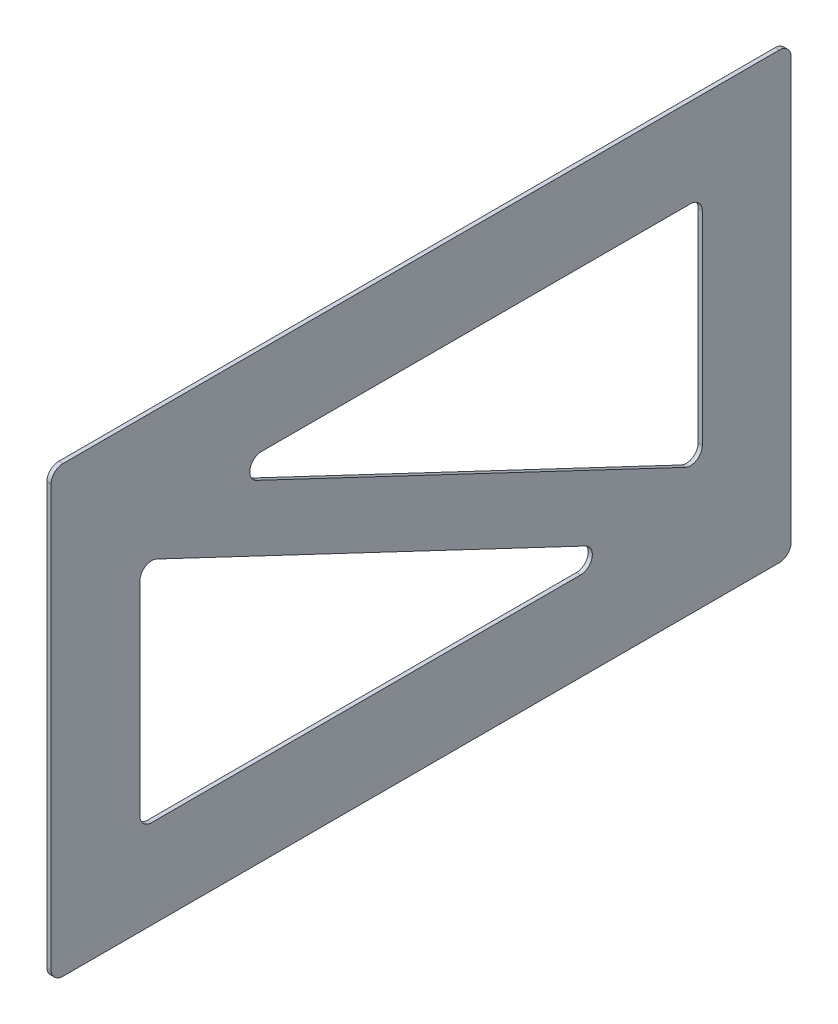
from build123d import *

# Parameters (mm, degrees)
SKETCH1_W          = 125
SKETCH1_H          = 75
BASE_FLANGE1_DEPTH = 0.7
CUT_EXTRUDE1_DEPTH = 10
FILLET1_R          = 2


# Sheet-metal steps are written as plain solids
with BuildPart() as part:
    # Sketch1 → Base-Flange1 (new body)
    with BuildSketch(Plane(origin=(0, 0, 0), x_dir=(0, 0, -1), z_dir=(1, 0, 0))):
        Rectangle(SKETCH1_W, SKETCH1_H)
    extrude(amount=-BASE_FLANGE1_DEPTH)

    # Sketch10 → Cut-Extrude1 (cut)
    with BuildSketch(Plane(origin=(0, 0, 0), x_dir=(0, 0, -1), z_dir=(1, 0, 0))):
        Polygon((35.82011331, -22.5), (-47.5, 16.967422094), (-47.5, -22.5), align=None)
        Polygon((47.5, 22.5), (-35.82011331, 22.5), (47.5, -16.967422094), align=None)
    extrude(amount=-CUT_EXTRUDE1_DEPTH, mode=Mode.SUBTRACT)

    # Fillet1
    fillet1_edges = [part.edges().sort_by_distance(p)[0] for p in [
        (-0.35, 16.967422094, 47.5),
        (-0.35, -22.5, -35.82011331),
        (-0.35, -22.5, 47.5),
        (-0.35, 22.5, 35.82011331),
        (-0.35, 22.5, -47.5),
        (-0.35, -16.967422094, -47.5),
        (-0.35, -37.5, -62.5),
        (-0.35, -37.5, 62.5),
        (-0.35, 37.5, 62.5),
        (-0.35, 37.5, -62.5),
    ]]
    fillet(fillet1_edges, radius=FILLET1_R)


solid = part.part
